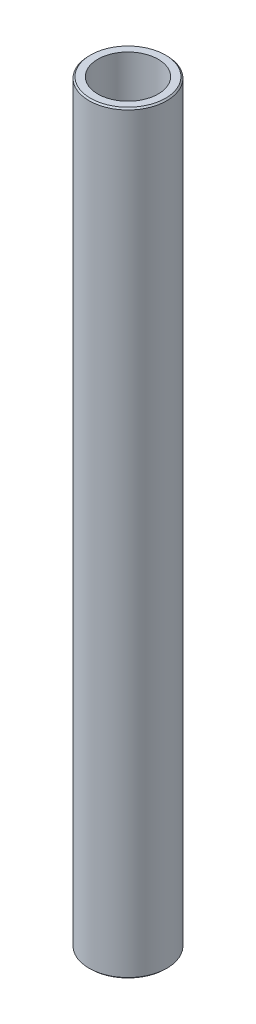
from build123d import *
from OCP.BRepFilletAPI import BRepFilletAPI_MakeChamfer

# Parameters (mm, degrees)
SKETCH1_R           = 20
BOSS_EXTRUDE1_DEPTH = 387.864817957
SKETCH2_R           = 15.521325443
CUT_EXTRUDE1_DEPTH  = 389.894737697
CHAMFER1_SIZE       = 0.739654517
CHAMFER1_SIZE2      = 0.712931181


with BuildPart() as part:
    # Sketch1 → Boss-Extrude1 (new body)
    with BuildSketch(Plane(origin=(0, 0, 0), x_dir=(1, 0, 0), z_dir=(0, 1, 0))):
        Circle(SKETCH1_R)
    extrude(amount=BOSS_EXTRUDE1_DEPTH)

    # Sketch2 → Cut-Extrude1 (cut, through all)
    with BuildSketch(Plane(origin=(0, 0, 0), x_dir=(1, 0, 0), z_dir=(0, 1, 0))):
        Circle(SKETCH2_R)
    extrude(amount=CUT_EXTRUDE1_DEPTH, mode=Mode.SUBTRACT)

    # Chamfer1: one chamfer whose edges measure the first distance from different faces: ONE call of the kernel's chamfer builder (chamfer() names one face for all edges)
    chamfer1_edges_1 = [part.edges().sort_by_distance(p)[0] for p in [
        (-20, 387.864817957, 0),
    ]]
    chamfer1_side_1 = [part.faces().sort_by_distance(p)[0] for p in [
        (-20, 193.932408978, 0),
    ]]
    chamfer1_edges_2 = [part.edges().sort_by_distance(p)[0] for p in [
        (-20, 0, 0),
    ]]
    chamfer1_side_2 = [part.faces().sort_by_distance(p)[0] for p in [
        (-19.434314575, 0, 0),
    ]]
    chamfer1 = BRepFilletAPI_MakeChamfer(part.part.solid().wrapped)
    for e in chamfer1_edges_1:
        chamfer1.Add(CHAMFER1_SIZE, CHAMFER1_SIZE2, e.wrapped, chamfer1_side_1[0].wrapped)  # the first distance lies on this face
    for e in chamfer1_edges_2:
        chamfer1.Add(CHAMFER1_SIZE, CHAMFER1_SIZE2, e.wrapped, chamfer1_side_2[0].wrapped)  # the first distance lies on this face
    add(Compound.cast(chamfer1.Shape()), mode=Mode.REPLACE)


solid = part.part
